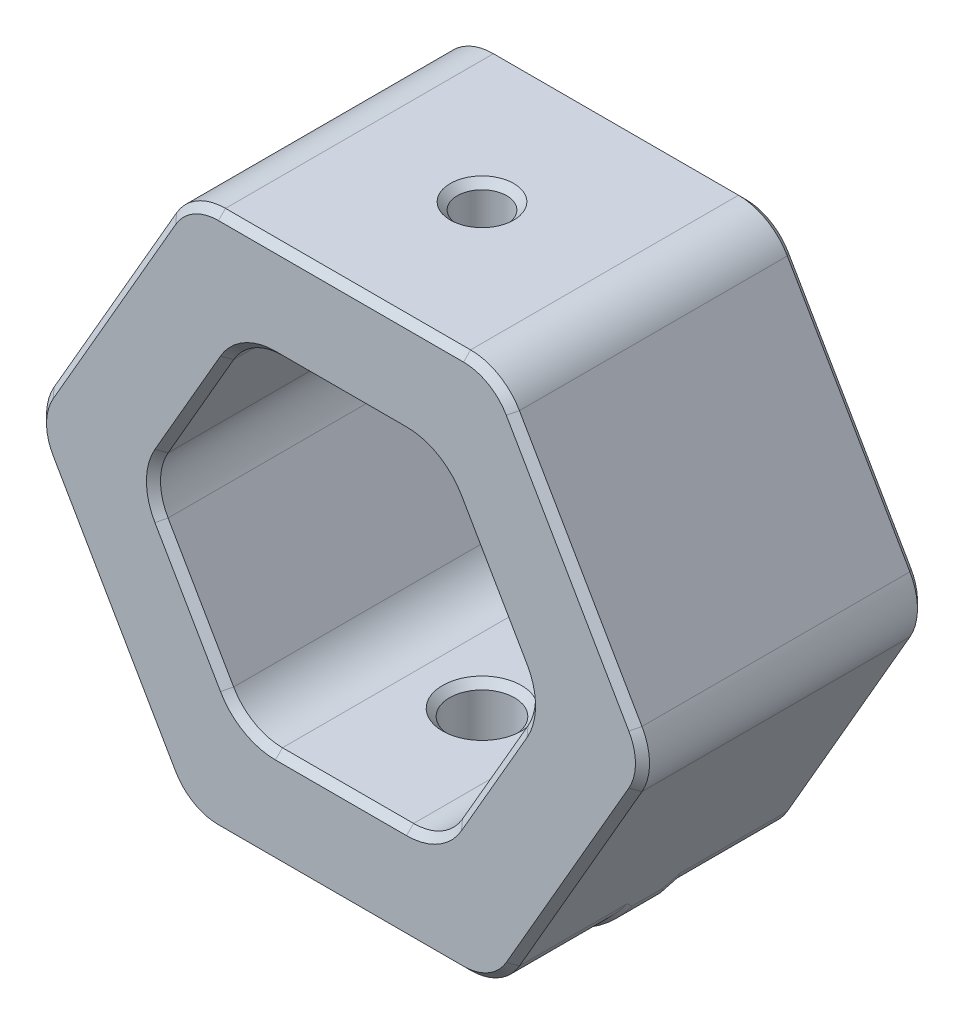
from build123d import *

# Parameters (mm, degrees)
AUFSATZ_LINEAR_AUSTRAGEN1_DEPTH             = 20
AUFSATZ_LINEAR_AUSTRAGEN2_REACH             = 50.332
AUFSATZ_LINEAR_AUSTRAGEN2_DIRECTION_2_REACH = 50.332
SKIZZE2_R                                   = 2.3
SCHNITT_LINEAR_AUSTRAGEN1_DEPTH             = 20
SKIZZE4_R                                   = 4.2
SCHNITT_LINEAR_AUSTRAGEN2_DEPTH             = 20
VERRUNDUNG1_R                               = 0.75
VERRUNDUNG2_R                               = 4
SKIZZE5_R                                   = 1.7499999999999998
SCHNITT_LINEAR_AUSTRAGEN3_DEPTH             = 20
FASE1_SIZE                                  = 0.5


with BuildPart() as part:
    # Skizze1 → Aufsatz-Linear austragen1 (new body)
    with BuildSketch(Plane.XY):
        Polygon((-11, 0), (11, 0), (21.999999999999947, 19.052558883257674), (10.999999999999858, 38.10511776651528), (-10.999999999999858, 38.10511776651528), (-21.999999999999947, 19.052558883257674), align=None)
        Polygon((0, 7), (6.958548115672608, 7), (13.917096231345187, 19.052558883257657), (6.958548115672503, 31.105117766515278), (-6.958548115672498, 31.105117766515278), (-13.917096231345184, 19.05255888325765), (-6.958548115672604, 7), align=None, mode=Mode.SUBTRACT)
    extrude(amount=AUFSATZ_LINEAR_AUSTRAGEN1_DEPTH)

    # Aufsatz-Linear austragen2: up to this plane
    aufsatz_linear_austragen2_end = Plane(origin=(11, 0, 20), z_dir=(-0.86602540378444, 0.4999999999999978, 0))
    # Skizze3 → Aufsatz-Linear austragen2 (add, up to the surface)
    with BuildSketch(Plane(origin=(0, 0, 0), x_dir=(0, 0, -1), z_dir=(1, 0, 0)), mode=Mode.PRIVATE) as aufsatz_linear_austragen2_sk1:
        Polygon((-13.5, 8.3e-16), (-6.500000000000001, 8.3e-16), (-7.250000000000007, -0.7499999999999989), (-12.749999999999995, -0.7499999999999989), align=None)
    aufsatz_linear_austragen2_tool1 = split(extrude(aufsatz_linear_austragen2_sk1.sketch, amount=AUFSATZ_LINEAR_AUSTRAGEN2_REACH, mode=Mode.PRIVATE), bisect_by=aufsatz_linear_austragen2_end, keep=Keep.BOTH, mode=Mode.PRIVATE)
    add(aufsatz_linear_austragen2_tool1.solids().sort_by_distance((0, -0.36, 10))[0])

    # Aufsatz-Linear austragen2 direction 2: up to this plane
    aufsatz_linear_austragen2_direction_2_end = Plane(origin=(-11, 0, 20), z_dir=(0.86602540378444, 0.4999999999999978, 0))
    # Skizze3 → Aufsatz-Linear austragen2 direction 2 (add, up to the surface)
    with BuildSketch(Plane(origin=(0, 0, 0), x_dir=(0, 0, -1), z_dir=(1, 0, 0)), mode=Mode.PRIVATE) as aufsatz_linear_austragen2_direction_2_sk1:
        Polygon((-13.5, 8.3e-16), (-6.500000000000001, 8.3e-16), (-7.250000000000007, -0.7499999999999989), (-12.749999999999995, -0.7499999999999989), align=None)
    aufsatz_linear_austragen2_direction_2_tool1 = split(extrude(aufsatz_linear_austragen2_direction_2_sk1.sketch, amount=-AUFSATZ_LINEAR_AUSTRAGEN2_DIRECTION_2_REACH, mode=Mode.PRIVATE), bisect_by=aufsatz_linear_austragen2_direction_2_end, keep=Keep.BOTH, mode=Mode.PRIVATE)
    add(aufsatz_linear_austragen2_direction_2_tool1.solids().sort_by_distance((0, -0.36, 10))[0])

    # Skizze2 → Schnitt-Linear austragen1 (cut)
    with BuildSketch(Plane(origin=(0, 7, 0), x_dir=(1, 0, 0), z_dir=(0, 1, 0))):
        with Locations(Location((6.94e-15, -10, 0), (0, 0, 270))):
            Circle(SKIZZE2_R)
    extrude(amount=-SCHNITT_LINEAR_AUSTRAGEN1_DEPTH, mode=Mode.SUBTRACT)

    # Skizze4 → Schnitt-Linear austragen2 (cut)
    with BuildSketch(Plane.XZ):
        with Locations((6.94e-15, 10)):
            Circle(SKIZZE4_R)
    extrude(amount=SCHNITT_LINEAR_AUSTRAGEN2_DEPTH, mode=Mode.SUBTRACT)

    # Verrundung1
    verrundung1_edges = [part.edges().sort_by_distance(p)[0] for p in [
        (-4.199999999999993, -0.7499999999999989, 10),
        (4.200000000000008, -0.7499999999999989, 10),
    ]]
    fillet(verrundung1_edges, radius=VERRUNDUNG1_R - 0.0001)  # a hair under: the kernel refuses the full size

    # Verrundung2
    verrundung2_edges = [part.edges().sort_by_distance(p)[0] for p in [
        (11, 0, 16.75),
        (-11, 0, 16.75),
        (-21.999999999999947, 19.052558883257674, 10),
        (-10.999999999999858, 38.10511776651528, 10),
        (10.999999999999858, 38.10511776651528, 10),
        (21.999999999999947, 19.052558883257674, 10),
        (-6.958548115672604, 7, 10),
        (6.958548115672608, 7, 10),
        (13.917096231345187, 19.052558883257657, 10),
        (6.958548115672503, 31.105117766515278, 10),
        (-6.958548115672498, 31.105117766515278, 10),
        (-13.917096231345184, 19.05255888325765, 10),
        (11, 0, 3.2500000000000004),
        (-11, 0, 3.2500000000000004),
        (10.783493649053893, -0.3750000000000009, 6.875000000000002),
        (10.566987298107785, -0.749999999999999, 10),
        (10.783493649053893, -0.37499999999999845, 13.124999999999996),
        (-10.783493649053893, -0.37499999999999845, 13.124999999999996),
        (-10.783493649053893, -0.3750000000000009, 6.875000000000002),
        (-10.566987298107785, -0.749999999999999, 10),
    ]]
    fillet(verrundung2_edges, radius=VERRUNDUNG2_R)

    # Skizze5 → Schnitt-Linear austragen3 (cut)
    with BuildSketch(Plane.XZ.offset(-31.105117766515278)):
        with Locations(Location((6.94e-15, 10, 0), (0, 0, 270))):
            Circle(SKIZZE5_R)
    extrude(amount=-SCHNITT_LINEAR_AUSTRAGEN3_DEPTH, mode=Mode.SUBTRACT)

    # Fase1
    fase1_edges = [part.edges().sort_by_distance(p)[0] for p in [
        (-10.437822173508891, 13.026279441628823, 0),
        (-21.38119784648294, 19.052558883257667, 0),
        (-10.69059892324136, 37.569219381653035, 0),
        (10.69059892324136, 37.569219381653035, 0),
        (21.38119784648294, 19.052558883257674, 0),
        (-10.690598923241494, 0.5358983848622438, 0),
        (10.690598923241497, 0.5358983848622478, 0),
        (1.78e-15, 0, 20),
        (16.4999999999999, 28.578838324886483, 20),
        (0, 38.10511776651528, 20),
        (-16.4999999999999, 28.57883832488648, 20),
        (-16.49999999999997, 9.526279441628835, 20),
        (10.437822173508899, 13.02627944162883, 20),
        (8.9e-16, 7, 20),
        (-10.437822173508891, 13.026279441628823, 20),
        (-10.437822173508836, 25.078838324886473, 20),
        (2.66e-15, 31.105117766515278, 20),
        (10.437822173508838, 25.078838324886476, 20),
        (-21.38119784648294, 19.052558883257667, 20),
        (-10.69059892324136, 37.569219381653035, 20),
        (10.69059892324136, 37.569219381653035, 20),
        (21.38119784648294, 19.052558883257674, 20),
        (-10.690598923241494, 0.5358983848622438, 20),
        (10.690598923241497, 0.5358983848622478, 20),
        (13.298294077828178, 19.05255888325766, 0),
        (13.298294077828178, 19.05255888325766, 20),
        (6.649147038914101, 7.535898384862248, 0),
        (6.649147038914101, 7.535898384862248, 20),
        (-6.6491470389141, 7.5358983848622465, 0),
        (-6.6491470389141, 7.5358983848622465, 20),
        (-13.298294077828174, 19.052558883257642, 0),
        (-13.298294077828174, 19.052558883257642, 20),
        (-6.649147038914, 30.56921938165304, 0),
        (-6.649147038914, 30.56921938165304, 20),
        (6.649147038914005, 30.56921938165304, 0),
        (6.649147038914005, 30.56921938165304, 20),
        (7.47e-15, 38.10511776651528, 11.75),
        (7.47e-15, 31.105117766515278, 11.75),
        (7.64e-15, 7, 7.7),
        (7.64e-15, 0, 7.7),
        (16.499999999999975, 9.526279441628839, 0),
        (16.499999999999975, 9.526279441628839, 20),
        (1.78e-15, 0, 0),
        (-16.49999999999997, 9.526279441628835, 0),
        (-16.4999999999999, 28.57883832488648, 0),
        (0, 38.10511776651528, 0),
        (16.4999999999999, 28.578838324886483, 0),
        (0, 7, 0),
        (10.437822173508899, 13.02627944162883, 0),
        (10.437822173508838, 25.078838324886476, 0),
        (2.66e-15, 31.105117766515278, 0),
        (-10.437822173508836, 25.078838324886473, 0),
    ]]
    chamfer(fase1_edges, length=FASE1_SIZE)


solid = part.part
